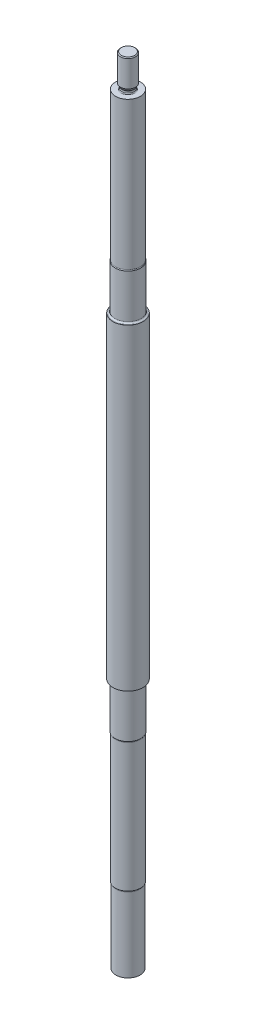
from build123d import *

# Parameters (mm, degrees)
SKETCH1_R           = 8
BOSS_EXTRUDE1_DEPTH = 50
SKETCH2_R           = 8.25
BOSS_EXTRUDE2_DEPTH = 86
SKETCH3_R           = 8.5
BOSS_EXTRUDE3_DEPTH = 30
SKETCH4_R           = 10
BOSS_EXTRUDE4_DEPTH = 210
SKETCH5_R           = 8.5
BOSS_EXTRUDE5_DEPTH = 30
SKETCH6_R           = 8.25
BOSS_EXTRUDE6_DEPTH = 95
SKETCH32_R          = 8.25
BOSS_EXTRUDE7_DEPTH = 25
CUT_EXTRUDE1_START  = -3.2
CUT_EXTRUDE1_DEPTH  = 523.990079724
FILLET1_R           = 1


# Read off the part's stored shape, not the designer's step: M10x1.0 Machine Threads Stud1
with BuildPart() as part:
    # Sketch1 → Boss-Extrude1 (new body)
    with BuildSketch(Plane(origin=(0, 0, 0), x_dir=(1, 0, 0), z_dir=(0, 1, 0))):
        with Locations(Location((0, 0, 0), (0, 0, 270))):
            Circle(SKETCH1_R)
    extrude(amount=BOSS_EXTRUDE1_DEPTH)

    # Sketch2 → Boss-Extrude2 (add)
    with BuildSketch(Plane(origin=(0, 50, 0), x_dir=(1, 0, 0), z_dir=(0, 1, 0))):
        with Locations(Location((0, 0, 0), (0, 0, 270))):
            Circle(SKETCH2_R)
    extrude(amount=BOSS_EXTRUDE2_DEPTH)

    # Sketch3 → Boss-Extrude3 (add)
    with BuildSketch(Plane(origin=(0, 136, 0), x_dir=(1, 0, 0), z_dir=(0, 1, 0))):
        with Locations(Location((0, 0, 0), (0, 0, 270))):
            Circle(SKETCH3_R)
    extrude(amount=BOSS_EXTRUDE3_DEPTH)

    # Sketch4 → Boss-Extrude4 (add)
    with BuildSketch(Plane(origin=(0, 166, 0), x_dir=(1, 0, 0), z_dir=(0, 1, 0))):
        with Locations(Location((0, 0, 0), (0, 0, 270))):
            Circle(SKETCH4_R)
    extrude(amount=BOSS_EXTRUDE4_DEPTH)

    # Sketch5 → Boss-Extrude5 (add)
    with BuildSketch(Plane(origin=(0, 376, 0), x_dir=(1, 0, 0), z_dir=(0, 1, 0))):
        with Locations(Location((0, 0, 0), (0, 0, 270))):
            Circle(SKETCH5_R)
    extrude(amount=BOSS_EXTRUDE5_DEPTH)

    # Sketch6 → Boss-Extrude6 (add)
    with BuildSketch(Plane(origin=(0, 406, 0), x_dir=(1, 0, 0), z_dir=(0, 1, 0))):
        with Locations(Location((0, 0, 0), (0, 0, 270))):
            Circle(SKETCH6_R)
    extrude(amount=BOSS_EXTRUDE6_DEPTH)

    # Sketch32 → Boss-Extrude7 (add)
    with BuildSketch(Plane(origin=(0, 501, 0), x_dir=(1, 0, 0), z_dir=(0, 1, 0))):
        with Locations(Location((0, 0, 0), (0, 0, 270))):
            Circle(SKETCH32_R)
    extrude(amount=BOSS_EXTRUDE7_DEPTH)

    # M10x1.0 Machine Threads Stud1 outline → M10x1.0 Machine Threads Stud1 (revolve, cut)
    with BuildSketch(Plane.XY):
        with BuildLine():
            Line((8.25, 526), (4.4455, 526))
            Line((4.4455, 526), (5, 525.4455))
            Line((5, 525.4455), (5, 508))
            Line((5, 508), (4.066987298, 506.383974596))
            ThreePointArc((4.066987298, 506.383974596), (4.017037087, 506.263384119), (4, 506.133974596))
            Line((4, 506.133974596), (4, 504.883974596))
            ThreePointArc((4, 504.883974596), (4.14644661, 504.530421205), (4.5, 504.383974596))
            Line((4.5, 504.383974596), (8.25, 504.383974596))
            Line((8.25, 504.383974596), (8.25, 526))
        make_face()
    revolve(axis=Axis((0, 0, 0), (0, 1, 0)), mode=Mode.SUBTRACT)

    # Sketch34 → Cut-Extrude1 (cut, through all)
    with BuildSketch(Plane.XY.offset(CUT_EXTRUDE1_START)):
        with BuildLine():
            Line((3, -11), (-3, -11))
            Line((-3, -11), (-3, 11))
            ThreePointArc((-3, 11), (0, 14), (3, 11))
            Line((3, 11), (3, -11))
        make_face()
    extrude(amount=-CUT_EXTRUDE1_DEPTH, mode=Mode.SUBTRACT)

    # Fillet1
    # the kernel refuses this fillet: 1 mm, written as the material it adds along each edge
    with BuildSketch(Plane(origin=(0, 376, 0), x_dir=(0, 0, 1), z_dir=(-1, 0, 0))) as fillet1_piece_1:
        with BuildLine():
            CenterArc((8.5 + FILLET1_R, FILLET1_R), FILLET1_R, 180, 90)
            Line((8.5, FILLET1_R), (8.5 - FILLET1_R * 0.02, FILLET1_R))
            Line((8.5 - FILLET1_R * 0.02, FILLET1_R), (8.5 - FILLET1_R * 0.02, -FILLET1_R * 0.02))
            Line((8.5 - FILLET1_R * 0.02, -FILLET1_R * 0.02), (8.5 + FILLET1_R, -FILLET1_R * 0.02))
            Line((8.5 + FILLET1_R, -FILLET1_R * 0.02), (8.5 + FILLET1_R, 0))
        make_face()
    revolve(axis=Axis((0, 376, 0), (0, 1, 0)))
    with BuildSketch(Plane(origin=(0, 406, 0), x_dir=(0, 0, 1), z_dir=(-1, 0, 0))) as fillet1_piece_2:
        with BuildLine():
            CenterArc((9.25, 0.661437828), FILLET1_R, 180, 41.409622109)
            Line((8.25, 0.661437828), (8.23, 0.661437828))
            Line((8.23, 0.661437828), (8.23, 0))
            Line((8.23, 0), (8.25, -0.02))
            ThreePointArc((8.25, -0.02), (8.375, -0.02), (8.485, -0.013228757))
            Line((8.485, -0.013228757), (8.5, 0))
        make_face()
    revolve(axis=Axis((0, 406, 0), (0, 1, 0)))
    with BuildSketch(Plane(origin=(0, 50, 0), x_dir=(0, 0, 1), z_dir=(-1, 0, 0))) as fillet1_piece_3:
        with BuildLine():
            CenterArc((9, -0.661437828), FILLET1_R, 138.590377891, 41.409622109)
            Line((8, -0.661437828), (7.98, -0.661437828))
            Line((7.98, -0.661437828), (7.98, 0))
            Line((7.98, 0), (8, 0.02))
            ThreePointArc((8, 0.02), (8.125, 0.02), (8.235, 0.013228757))
            Line((8.235, 0.013228757), (8.25, 0))
        make_face()
    revolve(axis=Axis((0, 50, 0), (0, 1, 0)))
    with BuildSketch(Plane(origin=(0, 136, 0), x_dir=(0, 0, 1), z_dir=(-1, 0, 0))) as fillet1_piece_4:
        with BuildLine():
            CenterArc((9.25, -0.661437828), FILLET1_R, 138.590377891, 41.409622109)
            Line((8.25, -0.661437828), (8.23, -0.661437828))
            Line((8.23, -0.661437828), (8.23, 0))
            Line((8.23, 0), (8.25, 0.02))
            ThreePointArc((8.25, 0.02), (8.375, 0.02), (8.485, 0.013228757))
            Line((8.485, 0.013228757), (8.5, 0))
        make_face()
    revolve(axis=Axis((0, 136, 0), (0, 1, 0)))
    with BuildSketch(Plane(origin=(0, 166, 0), x_dir=(0, 0, 1), z_dir=(-1, 0, 0))) as fillet1_piece_5:
        with BuildLine():
            CenterArc((8.5 + FILLET1_R, -FILLET1_R), FILLET1_R, 90, 90)
            Line((8.5, -FILLET1_R), (8.5 - FILLET1_R * 0.02, -FILLET1_R))
            Line((8.5 - FILLET1_R * 0.02, -FILLET1_R), (8.5 - FILLET1_R * 0.02, FILLET1_R * 0.02))
            Line((8.5 - FILLET1_R * 0.02, FILLET1_R * 0.02), (8.5 + FILLET1_R, FILLET1_R * 0.02))
            Line((8.5 + FILLET1_R, FILLET1_R * 0.02), (8.5 + FILLET1_R, 0))
        make_face()
    revolve(axis=Axis((0, 166, 0), (0, 1, 0)))


solid = part.part
